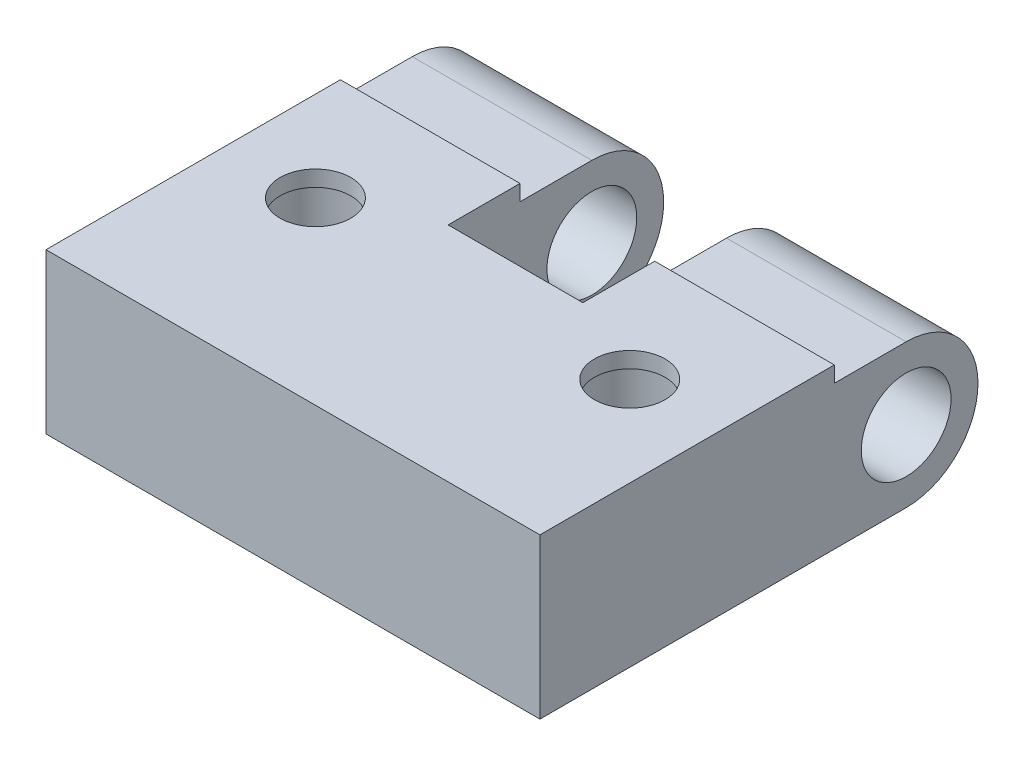
from build123d import *

# Parameters (mm, degrees)
SKETCH2_R           = 1.5875
BOSS_EXTRUDE1_DEPTH = 6.35
CUT_EXTRUDE1_DEPTH  = 10
BOSS_EXTRUDE2_DEPTH = 4.7625
BOSS_EXTRUDE3_DEPTH = 0.56250002
SKETCH7_R           = 1.25
CUT_EXTRUDE2_DEPTH  = 21.353004305


with BuildPart() as part:
    # Sketch2 → Boss-Extrude1 (new body)
    with BuildSketch(Plane(origin=(0, 0, 0), x_dir=(0, 0, -1), z_dir=(1, 0, 0))):
        with BuildLine():
            Line((6.597804878, 5.08), (-6.35, 5.08))
            Line((-6.35, 5.08), (-6.35, 0))
            Line((-6.35, 0), (6.597804878, 0))
            ThreePointArc((6.597804878, 0), (9.137804878, 2.54), (6.597804878, 5.08))
        make_face()
        with Locations((6.597804878, 2.54)):
            Circle(SKETCH2_R, mode=Mode.SUBTRACT)
    boss_extrude1 = extrude(amount=BOSS_EXTRUDE1_DEPTH)

    # Sketch3 → Cut-Extrude1 (cut)
    with BuildSketch(Plane(origin=(0, 5.08, 0), x_dir=(1, 0, 0), z_dir=(0, 1, 0))):
        with BuildLine():
            ThreePointArc((3.175, -1.5), (4.235660172, -1.060660172), (4.675, 0))
            ThreePointArc((4.675, 0), (2.114339828, 1.060660172), (3.175, -1.5))
        make_face()
    cut_extrude1 = extrude(amount=-CUT_EXTRUDE1_DEPTH, mode=Mode.SUBTRACT)

    # Sketch4 → Boss-Extrude2 (add)
    with BuildSketch(Plane(origin=(6.35, 0, 0), x_dir=(0, 0, -1), z_dir=(1, 0, 0))):
        Polygon((-6.35, 0), (1.517804878, 0), (1.517804878, 2.54), (1.517804878, 5.08), (-6.35, 5.08), align=None)
    extrude(amount=BOSS_EXTRUDE2_DEPTH)

    # Mirror1: Boss-Extrude1, Cut-Extrude1 across plane
    add(boss_extrude1.mirror(Plane(origin=(8.73125, 0, 0), x_dir=(0, 0, 1), z_dir=(1, 0, 0))))
    add(cut_extrude1.mirror(Plane(origin=(8.73125, 0, 0), x_dir=(0, 0, 1), z_dir=(1, 0, 0))), mode=Mode.SUBTRACT)

    # Sketch6 → Boss-Extrude3 (add)
    with BuildSketch(Plane(origin=(0, 5.08, 0), x_dir=(1, 0, 0), z_dir=(0, 1, 0))):
        Polygon((6.35, 4.057804878), (0, 4.057804878), (0, -6.35), (17.4625, -6.35), (17.4625, 4.057804878), (11.1125, 4.057804878), (11.1125, 1.517804878), (6.35, 1.517804878), align=None)
    extrude(amount=BOSS_EXTRUDE3_DEPTH)

    # Sketch7 → Cut-Extrude2 (cut, through all)
    with BuildSketch(Plane.XZ.offset(-5.08)):
        with Locations((14.2875, 0)):
            Circle(SKETCH7_R)
        with Locations((3.175, 0)):
            Circle(SKETCH7_R)
    extrude(amount=-CUT_EXTRUDE2_DEPTH, mode=Mode.SUBTRACT)


solid = part.part
